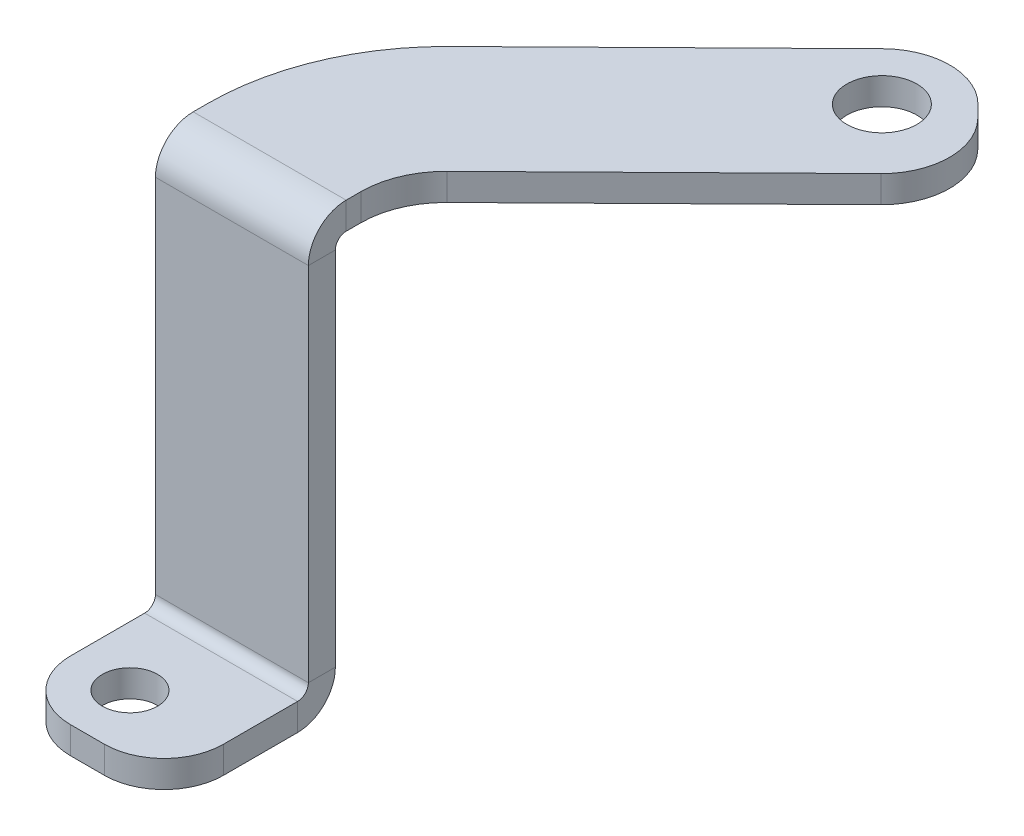
from build123d import *

# Parameters (mm, degrees)
SKETCH1_R                    = 3.25
BASE_FLANGE1_DEPTH           = 3.175
EDGE_FLANGE1_STRIP_W         = 15.24
EDGE_FLANGE1_STRIP_H         = 3.175
EDGE_FLANGE1_STRIP_CUT_DEPTH = 18
EDGE_FLANGE1_DEPTH           = 18
EDGE_FLANGE2_STRIP_W         = 15.24
EDGE_FLANGE2_STRIP_H         = 3.175
EDGE_FLANGE2_STRIP_CUT_DEPTH = 18
EDGE_FLANGE2_DEPTH           = 18
SKETCH12_R                   = 4.125
BOSS_EXTRUDE1_DEPTH          = 3.175


# Sheet-metal steps are written as plain solids
with BuildPart() as part:
    # Sketch1 → Base-Flange1 (new body)
    with BuildSketch(Plane(origin=(0, 0, 0), x_dir=(1, 0, 0), z_dir=(0, 1, 0))):
        with BuildLine():
            Line((-7, 10), (-7, 0))
            ThreePointArc((-7, 0), (-4.949747468, -4.949747468), (0, -7))
            Line((0, -7), (4, -7))
            ThreePointArc((4, -7), (8.949747468, -4.949747468), (11, 0))
            Line((11, 0), (11, 10))
            Line((11, 10), (-7, 10))
        make_face()
        with Locations(Location((0, 0, 0), (0, 0, 270))):
            Circle(SKETCH1_R, mode=Mode.SUBTRACT)
    extrude(amount=-BASE_FLANGE1_DEPTH)

    # Edge-Flange1 strip (across the edge) → Edge-Flange1 strip cut (cut)
    with BuildSketch(Plane(origin=(11, 0, -10), x_dir=(0, 0, 1), z_dir=(-1, 0, 0))):
        with Locations((-6.35, -1.5875)):
            Rectangle(EDGE_FLANGE1_STRIP_W, EDGE_FLANGE1_STRIP_H)
    extrude(amount=EDGE_FLANGE1_STRIP_CUT_DEPTH, mode=Mode.SUBTRACT)

    # Edge-Flange1 section (across the edge) → Edge-Flange1 (add)
    with BuildSketch(Plane(origin=(11, 0, -10), x_dir=(0, 0, 1), z_dir=(-1, 0, 0))):
        with BuildLine():
            Line((-3.175, 1.27), (-3.175, 45.0625))
            Line((-3.175, 45.0625), (0, 45.0625))
            Line((0, 45.0625), (0, 1.27))
            ThreePointArc((0, 1.27), (0.371974388, 0.371974388), (1.27, 0))
            Line((1.27, 0), (1.27, -3.175))
            ThreePointArc((1.27, -3.175), (-1.873089642, -1.873089642), (-3.175, 1.27))
        make_face()
    extrude(amount=EDGE_FLANGE1_DEPTH)

    # Edge-Flange2 strip (across the edge) → Edge-Flange2 strip cut (cut)
    with BuildSketch(Plane(origin=(-7, 45.0625, -13.175), x_dir=(0, -1, 0), z_dir=(1, 0, 0))):
        with Locations((-6.35, -1.5875)):
            Rectangle(EDGE_FLANGE2_STRIP_W, EDGE_FLANGE2_STRIP_H)
    extrude(amount=EDGE_FLANGE2_STRIP_CUT_DEPTH, mode=Mode.SUBTRACT)

    # Edge-Flange2 section (across the edge) → Edge-Flange2 (add)
    with BuildSketch(Plane(origin=(-7, 45.0625, -13.175), x_dir=(0, -1, 0), z_dir=(1, 0, 0))):
        with BuildLine():
            Line((-3.175, 1.27), (-3.175, 3))
            Line((-3.175, 3), (0, 3))
            Line((0, 3), (0, 1.27))
            ThreePointArc((0, 1.27), (0.371974388, 0.371974388), (1.27, 0))
            Line((1.27, 0), (1.27, -3.175))
            ThreePointArc((1.27, -3.175), (-1.873089642, -1.873089642), (-3.175, 1.27))
        make_face()
    extrude(amount=EDGE_FLANGE2_DEPTH)

    # Sketch12 → Boss-Extrude1 (add)
    with BuildSketch(Plane(origin=(0, 48.2375, 0), x_dir=(1, 0, 0), z_dir=(0, 1, 0))):
        with BuildLine():
            Line((11, 16.175), (-7, 16.175))
            ThreePointArc((-7, 16.175), (-4.820309554, 27.006048634), (1.379401037, 36.150787753))
            Line((1.379401037, 36.150787753), (27.144104233, 61.457369654))
            ThreePointArc((27.144104233, 61.457369654), (32.821748623, 63.749679884), (38.457357581, 61.355887143))
            Line((38.457357581, 61.355887143), (39.858828935, 59.92904516))
            ThreePointArc((39.858828935, 59.92904516), (42.151139165, 54.251400771), (39.757346424, 48.615791813))
            Line((39.757346424, 48.615791813), (13.992643228, 23.309209912))
            ThreePointArc((13.992643228, 23.309209912), (11.778460873, 20.043231655), (11, 16.175))
        make_face()
        with Locations(Location((32.749989651, 55.750001725, 0), (0, 0, 270))):
            Circle(SKETCH12_R, mode=Mode.SUBTRACT)
    extrude(amount=-BOSS_EXTRUDE1_DEPTH)


solid = part.part
